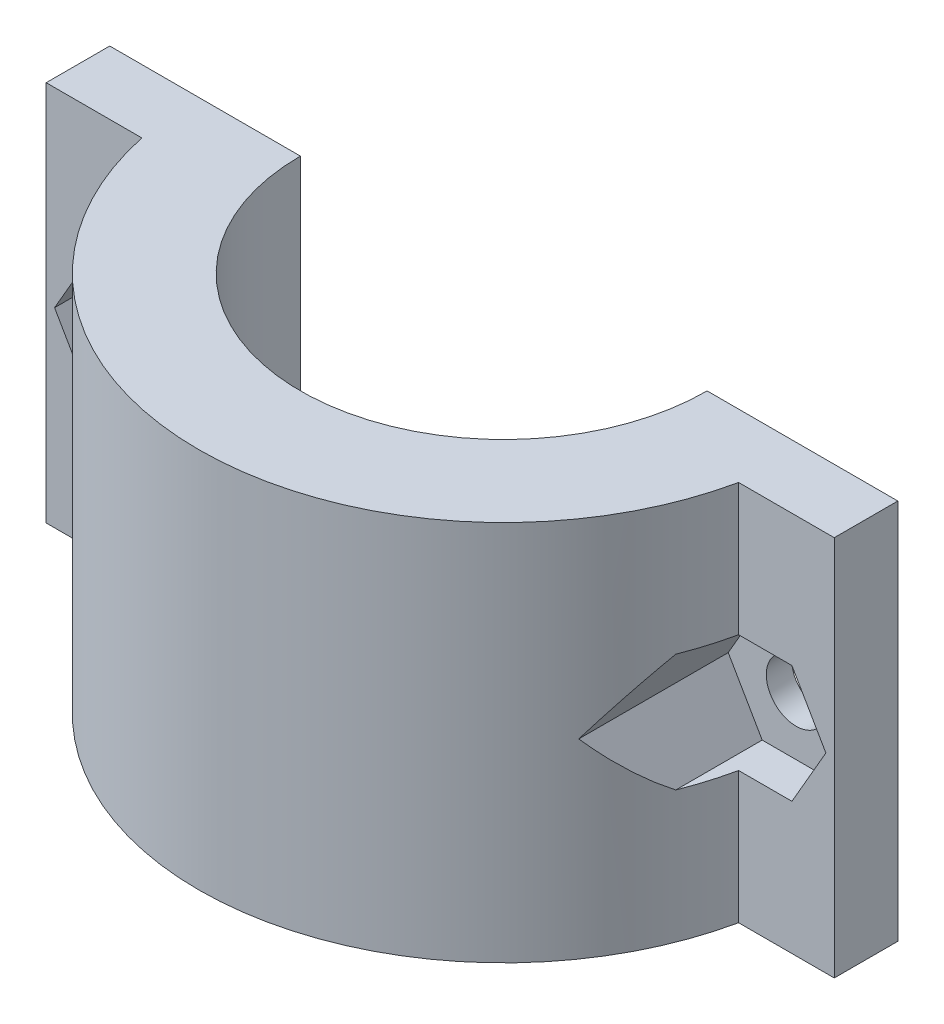
from build123d import *

# Parameters (mm, degrees)
BOSS_EXTRUDE1_DEPTH   = 30
CUT_EXTRUDE1_DEPTH    = 50
SKETCH2_7_R           = 2.35
CUT_EXTRUDE5_DEPTH    = 5
SKETCH2_10_R          = 2.35
CUT_EXTRUDE8_DEPTH    = 3
BODY_MOVE_COPY1_ANGLE = 90


with BuildPart() as part:
    # Sketch1 → Boss-Extrude1 (new body)
    with BuildSketch(Plane(origin=(0, 0, 0), x_dir=(1, 0, 0), z_dir=(0, 1, 0))):
        with BuildLine():
            Line((0, -16), (0, -31))
            Line((0, -31), (-5, -31))
            Line((-5, -31), (-5, -23.473389189))
            ThreePointArc((-5, -23.473389189), (-24, 0), (-5, 23.473389189))
            Line((-5, 23.473389189), (-5, 31))
            Line((-5, 31), (0, 31))
            Line((0, 31), (0, 16))
            ThreePointArc((0, 16), (-16, 0), (0, -16))
        make_face()
    extrude(amount=BOSS_EXTRUDE1_DEPTH)

    # Sketch2 → Cut-Extrude1 (cut)
    with BuildSketch(Plane.ZY.offset(5)):
        Polygon((-23.473389189, 10.375), (-22.329755005, 10.375), (-19.65951001, 15), (-22.329755005, 19.625), (-23.473389189, 19.625), align=None)
        Polygon((23.473389189, 19.625), (22.329755005, 19.625), (19.65951001, 15), (22.329755005, 10.375), (23.473389189, 10.375), align=None)
    extrude(amount=CUT_EXTRUDE1_DEPTH, mode=Mode.SUBTRACT)

    # Sketch2<7> → Cut-Extrude5 (cut)
    with BuildSketch(Plane.ZY.offset(5)):
        with Locations((-25, 15)):
            Circle(SKETCH2_7_R)
        with Locations((25, 15)):
            Circle(SKETCH2_7_R)
    extrude(amount=-CUT_EXTRUDE5_DEPTH, mode=Mode.SUBTRACT)

    # Sketch2<10> → Cut-Extrude8 (cut)
    # profile 1 of 2: a face of its own
    with BuildSketch(Plane.ZY.offset(5)):
        Polygon((-22.329755005, 10.375), (-19.65951001, 15), (-22.329755005, 19.625), (-27.670244995, 19.625), (-30.34048999, 15), (-27.670244995, 10.375), align=None)
        with Locations((-25, 15)):
            Circle(SKETCH2_10_R, mode=Mode.SUBTRACT)
    # profile 2 of 2: a face of its own
    with BuildSketch(Plane.ZY.offset(5)):
        Polygon((27.670244995, 19.625), (30.34048999, 15), (27.670244995, 10.375), (22.329755005, 10.375), (19.65951001, 15), (22.329755005, 19.625), align=None)
        with Locations((25, 15)):
            Circle(SKETCH2_10_R, mode=Mode.SUBTRACT)
    extrude(amount=-CUT_EXTRUDE8_DEPTH, mode=Mode.SUBTRACT)


with BuildPart() as part_1:
    # Body-Move/Copy1: read off the stored shape, not the designer's step
    # Body-Move/Copy1: moved
    add(part.part.moved(Location((0, 0, 16))).rotate(Axis((0, 0, 0), (0, 1, 0)), BODY_MOVE_COPY1_ANGLE))


solid = part_1.part
